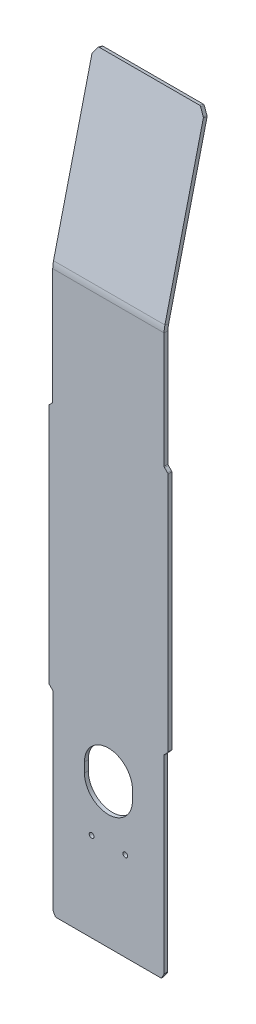
from build123d import *

# Parameters (mm, degrees)
SKETCH1_R              = 5
EXTRUDE1_DEPTH         = 8
PROCESS_BENDS1_START   = -116
PROCESS_BENDS1_DEPTH   = 232
PROCESS_BENDS1_2_DEPTH = 232
PROCESS_BENDS1_START_2 = 273
PROCESS_BENDS1_3_DEPTH = 10
SK_RPNING1_SIZE        = 6


with BuildPart() as part:
    # Sketch1 → Extrude1 (new body)
    with BuildSketch(Plane.XY):
        with BuildLine():
            Line((-108.645898034, 0), (108.645898034, 0))
            ThreePointArc((108.645898034, 0), (110.22309137, 0.448047575), (111.329179607, 1.658359214))
            Line((111.329179607, 1.658359214), (115.183281573, 9.366563146))
            ThreePointArc((115.183281573, 9.366563146), (115.419746968, 10.018945171), (115.5, 10.708203932))
            Line((115.5, 10.708203932), (115.5, 404.257359313))
            ThreePointArc((115.5, 404.257359313), (115.728361402, 405.40540961), (116.378679656, 406.378679656))
            Line((116.378679656, 406.378679656), (123.121320344, 413.121320344))
            ThreePointArc((123.121320344, 413.121320344), (123.771638598, 414.09459039), (124, 415.242640687))
            Line((124, 415.242640687), (124, 915.757359313))
            ThreePointArc((124, 915.757359313), (123.771638598, 916.90540961), (123.121320344, 917.878679656))
            Line((123.121320344, 917.878679656), (116.878679656, 924.121320344))
            ThreePointArc((116.878679656, 924.121320344), (116.228361402, 925.09459039), (116, 926.242640687))
            Line((116, 926.242640687), (116, 1522.091673087))
            ThreePointArc((116, 1522.091673087), (115.871276079, 1522.961025533), (115.496150883, 1523.755773675))
            Line((115.496150883, 1523.755773675), (106.890599608, 1536.664100589))
            ThreePointArc((106.890599608, 1536.664100589), (105.810022501, 1537.645023796), (104.394448725, 1538))
            Line((104.394448725, 1538), (-104.394448725, 1538))
            ThreePointArc((-104.394448725, 1538), (-105.810022501, 1537.645023796), (-106.890599608, 1536.664100589))
            Line((-106.890599608, 1536.664100589), (-115.496150883, 1523.755773675))
            ThreePointArc((-115.496150883, 1523.755773675), (-115.871276079, 1522.961025533), (-116, 1522.091673087))
            Line((-116, 1522.091673087), (-116, 926.242640687))
            ThreePointArc((-116, 926.242640687), (-116.228361402, 925.09459039), (-116.878679656, 924.121320344))
            Line((-116.878679656, 924.121320344), (-123.121320344, 917.878679656))
            ThreePointArc((-123.121320344, 917.878679656), (-123.771638598, 916.90540961), (-124, 915.757359313))
            Line((-124, 915.757359313), (-124, 415.242640687))
            ThreePointArc((-124, 415.242640687), (-123.771638598, 414.09459039), (-123.121320344, 413.121320344))
            Line((-123.121320344, 413.121320344), (-116.378679656, 406.378679656))
            ThreePointArc((-116.378679656, 406.378679656), (-115.728361402, 405.40540961), (-115.5, 404.257359313))
            Line((-115.5, 404.257359313), (-115.5, 10.708203932))
            ThreePointArc((-115.5, 10.708203932), (-115.419746968, 10.018945171), (-115.183281573, 9.366563146))
            Line((-115.183281573, 9.366563146), (-111.329179607, 1.658359214))
            ThreePointArc((-111.329179607, 1.658359214), (-110.22309137, 0.448047575), (-108.645898034, 0))
        make_face()
        with Locations((-35, 185)):
            Circle(SKETCH1_R, mode=Mode.SUBTRACT)
        with Locations(Location((35, 185, 0), (0, 0, 180))):
            Circle(SKETCH1_R, mode=Mode.SUBTRACT)
        with BuildLine():
            Line((-50, 290), (-50, 310))
            ThreePointArc((-50, 310), (0, 360), (50, 310))
            Line((50, 310), (50, 290))
            ThreePointArc((50, 290), (0, 240), (-50, 290))
        make_face(mode=Mode.SUBTRACT)
    extrude(amount=EXTRUDE1_DEPTH)

    # Process-Bends1: read off the stored shape, not the designer's step
    # Process-Bends1 outline → Process-Bends1 (cut)
    with BuildSketch(Plane.YZ.offset(PROCESS_BENDS1_START)):
        with BuildLine():
            Line((1180.17810598, 6.397455383), (1206.825425416, 0))
            Line((1206.825425416, 0), (1538, 0))
            Line((1538, 0), (1538, 8))
            Line((1538, 8), (1166.638274876, 8))
            ThreePointArc((1166.638274876, 8), (1173.455443929, 7.597970503), (1180.17810598, 6.397455383))
        make_face()
    extrude(amount=PROCESS_BENDS1_DEPTH, mode=Mode.SUBTRACT)

    # Process-Bends1 2 outline → Process-Bends1 2 (add)
    with BuildSketch(Plane.YZ.offset(PROCESS_BENDS1_START)):
        with BuildLine():
            Line((1527.039613862, -85.103946551), (1528.907176773, -77.324987188))
            Line((1528.907176773, -77.324987188), (1206.825425416, 0))
            Line((1206.825425416, 0), (1166.638274876, 0))
            ThreePointArc((1166.638274876, 0), (1172.515144749, -0.346577152), (1178.310543069, -1.38150398))
            Line((1178.310543069, -1.38150398), (1527.039613862, -85.103946551))
        make_face()
    extrude(amount=PROCESS_BENDS1_2_DEPTH)

    # Process-Bends1 3 outline → Process-Bends1 3 (cut)
    with BuildSketch(Plane(origin=(0, 0, 0), x_dir=(1, 0, 0), z_dir=(0, 0.2334453638559061, 0.9723699203976764)).offset(PROCESS_BENDS1_START_2)):
        with BuildLine():
            ThreePointArc((-116, 1488.806182631), (-115.871276079, 1489.675535077), (-115.496150883, 1490.470283219))
            Line((-115.496150883, 1490.470283219), (-106.890599608, 1503.378610132))
            ThreePointArc((-106.890599608, 1503.378610132), (-105.810022502, 1504.35953334), (-104.394448725, 1504.714509544))
            Line((-104.394448725, 1504.714509544), (-116, 1504.714509543))
            Line((-116, 1504.714509543), (-116, 1488.806182631))
        make_face()
        with BuildLine():
            Line((116, 1504.714509543), (104.394448725, 1504.714509544))
            ThreePointArc((104.394448725, 1504.714509544), (105.810022502, 1504.35953334), (106.890599608, 1503.378610132))
            Line((106.890599608, 1503.378610132), (115.496150883, 1490.470283219))
            ThreePointArc((115.496150883, 1490.470283219), (115.871276079, 1489.675535077), (116, 1488.806182631))
            Line((116, 1488.806182631), (116, 1504.714509543))
        make_face()
    extrude(amount=PROCESS_BENDS1_3_DEPTH, mode=Mode.SUBTRACT)

    # Skærpning1
    # the kernel refuses this chamfer: 6 mm, written as the material it takes off along each edge
    with BuildSketch(Plane(origin=(-124.075995962, 0, 0), x_dir=(0, 1, 0), z_dir=(1, 0, 0))) as sk_rpning1_piece_1:
        Polygon((SK_RPNING1_SIZE, 0), (0, SK_RPNING1_SIZE), (0, 0), align=None)
    extrude(amount=248.151991923, mode=Mode.SUBTRACT)
    with BuildSketch(Plane(origin=(-108.645898034, 3, 0), x_dir=(0.03163904554191759, -0.9994993600784327, 0), z_dir=(-0.9994993600784327, -0.03163904554191759, 0))) as sk_rpning1_piece_2_section:
        Polygon((0, 3), (3, SK_RPNING1_SIZE), (3, 0), (0, 0), align=None)
    sk_rpning1_piece_2 = revolve(axis=Axis((-108.645898034, 3, 0), (0, 0, 1)), revolution_arc=358.186913645, mode=Mode.PRIVATE)
    sk_rpning1_piece_2 = split(sk_rpning1_piece_2, bisect_by=Plane(origin=(-108.645898034, 4.5, 1.5), z_dir=(0, -0.7071067811865483, -0.7071067811865468)), keep=Keep.TOP, mode=Mode.PRIVATE)
    add(sk_rpning1_piece_2, mode=Mode.SUBTRACT)
    with BuildSketch(Plane(origin=(108.645898034, 3, 0), x_dir=(0, -1, 0), z_dir=(-1, 0, 0))) as sk_rpning1_piece_3_section:
        Polygon((0, 3), (3, SK_RPNING1_SIZE), (3, 0), (0, 0), align=None)
    sk_rpning1_piece_3 = revolve(axis=Axis((108.645898034, 3, 0), (0, 0, 1)), revolution_arc=358.186913645, mode=Mode.PRIVATE)
    sk_rpning1_piece_3 = split(sk_rpning1_piece_3, bisect_by=Plane(origin=(108.645898034, 4.5, 1.5), z_dir=(0, -0.7071067811865483, -0.7071067811865468)), keep=Keep.TOP, mode=Mode.PRIVATE)
    add(sk_rpning1_piece_3, mode=Mode.SUBTRACT)


solid = part.part
